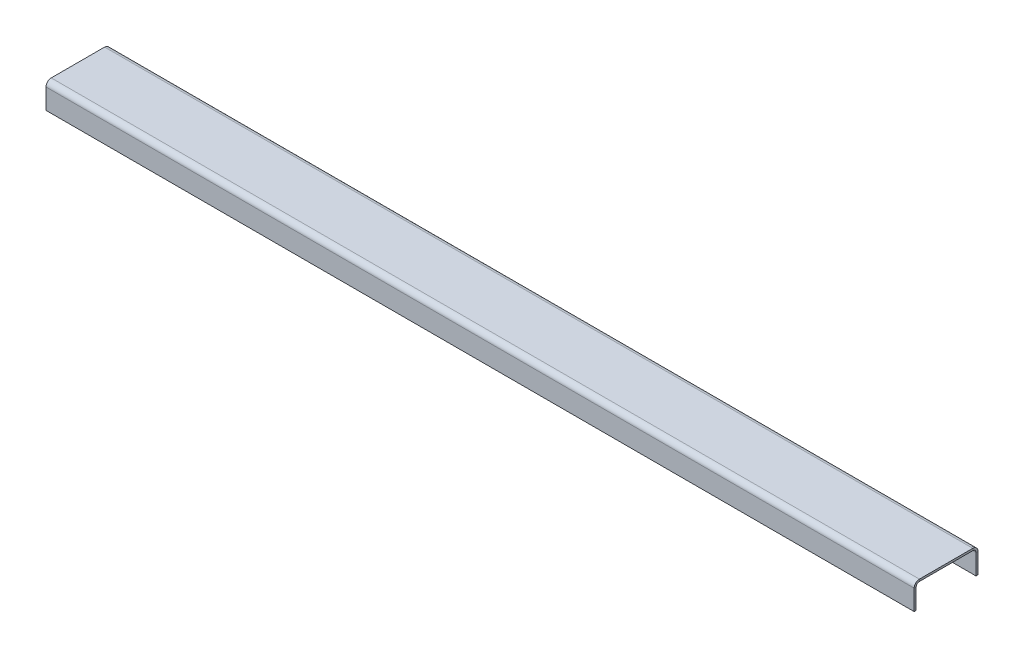
from build123d import *

# Parameters (mm, degrees)
SKETCH1_W                      = 863.6
SKETCH1_H                      = 63.5
BASE_FLANGE1_DEPTH             = 2.032
EDGE_FLANGE1_STRIP_W           = 14.478
EDGE_FLANGE1_STRIP_H           = 2.032
EDGE_FLANGE1_STRIP_CUT_DEPTH   = 863.6
EDGE_FLANGE1_STRIP_2_W         = 14.478
EDGE_FLANGE1_STRIP_2_H         = 2.032
EDGE_FLANGE1_STRIP_CUT_2_DEPTH = 863.6
EDGE_FLANGE1_DEPTH             = 863.6
EDGE_FLANGE1_BEND_DEPTH        = 863.6


# Sheet-metal steps are written as plain solids
with BuildPart() as part:
    # Sketch1 → Base-Flange1 (new body)
    with BuildSketch(Plane(origin=(0, 0, 0), x_dir=(1, 0, 0), z_dir=(0, 1, 0))):
        with Locations((431.8, 31.75)):
            Rectangle(SKETCH1_W, SKETCH1_H)
    extrude(amount=-BASE_FLANGE1_DEPTH)

    # Edge-Flange1 strip (across the edge) → Edge-Flange1 strip cut (cut)
    with BuildSketch(Plane(origin=(863.6, -2.032, 0), x_dir=(0, 0, -1), z_dir=(-1, 0, 0))):
        with Locations((-2.032, -1.016)):
            Rectangle(EDGE_FLANGE1_STRIP_W, EDGE_FLANGE1_STRIP_H)
    extrude(amount=EDGE_FLANGE1_STRIP_CUT_DEPTH, mode=Mode.SUBTRACT)

    # Edge-Flange1 strip 2 (across the edge) → Edge-Flange1 strip cut 2 (cut)
    with BuildSketch(Plane(origin=(0, -2.032, -63.5), x_dir=(0, 0, 1), z_dir=(1, 0, 0))):
        with Locations((-2.032, -1.016)):
            Rectangle(EDGE_FLANGE1_STRIP_2_W, EDGE_FLANGE1_STRIP_2_H)
    extrude(amount=EDGE_FLANGE1_STRIP_CUT_2_DEPTH, mode=Mode.SUBTRACT)

    # Edge-Flange1 section (across the edge) → Edge-Flange1 (add)
    with BuildSketch(Plane(origin=(863.6, -2.032, 0), x_dir=(0, 0, -1), z_dir=(-1, 0, 0))):
        with BuildLine():
            Line((0, 3.175), (0, 23.368))
            Line((0, 23.368), (2.032, 23.368))
            Line((2.032, 23.368), (2.032, 3.175))
            ThreePointArc((2.032, 3.175), (2.96193597, 0.92993597), (5.207, 0))
            Line((5.207, 0), (5.207, -2.032))
            ThreePointArc((5.207, -2.032), (1.52509499, -0.50690501), (0, 3.175))
        make_face()
    extrude(amount=EDGE_FLANGE1_DEPTH)

    # Edge-Flange1 section 2 (across the edge) → Edge-Flange1 bend (add)
    with BuildSketch(Plane(origin=(0, -2.032, -63.5), x_dir=(0, 0, 1), z_dir=(1, 0, 0))):
        with BuildLine():
            Line((0, 3.175), (0, 23.368))
            Line((0, 23.368), (2.032, 23.368))
            Line((2.032, 23.368), (2.032, 3.175))
            ThreePointArc((2.032, 3.175), (2.96193597, 0.92993597), (5.207, 0))
            Line((5.207, 0), (5.207, -2.032))
            ThreePointArc((5.207, -2.032), (1.52509499, -0.50690501), (0, 3.175))
        make_face()
    extrude(amount=EDGE_FLANGE1_BEND_DEPTH)


solid = part.part
